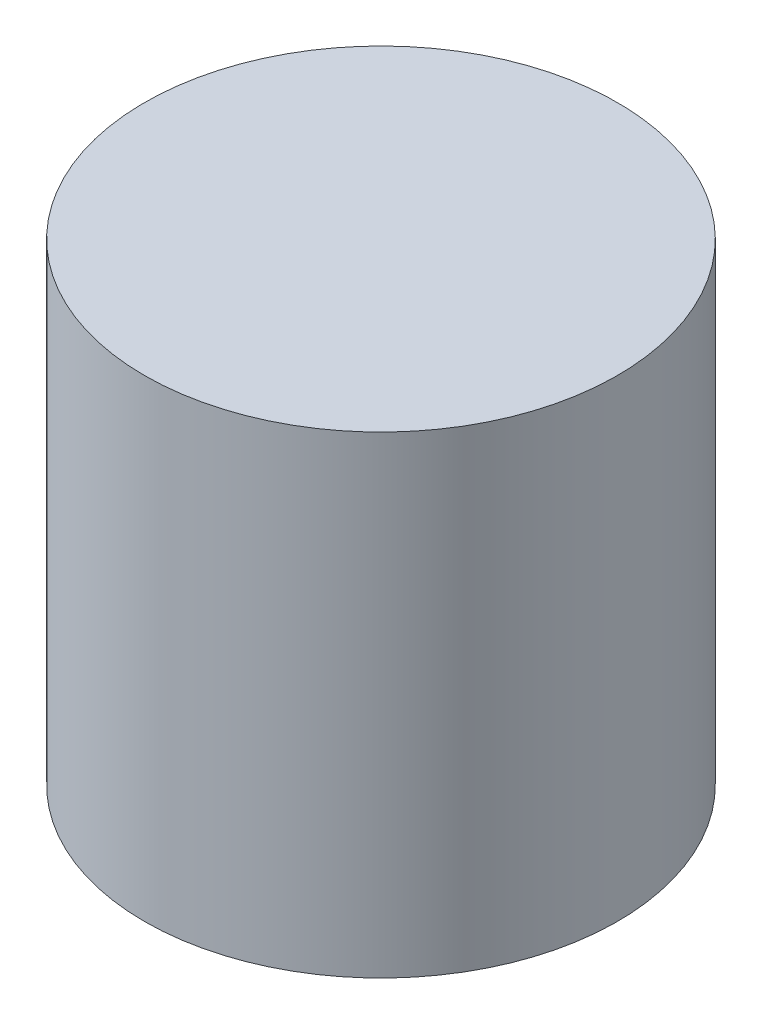
from build123d import *

# Parameters (mm, degrees)
ESQUISSE3_R        = 2
BOSS_EXTRU_1_DEPTH = 4


with BuildPart() as part:
    # Esquisse3 → Boss.-Extru.1 (new body)
    with BuildSketch(Plane(origin=(0, 0, 0), x_dir=(1, 0, 0), z_dir=(0, 1, 0))):
        Circle(ESQUISSE3_R)
    extrude(amount=BOSS_EXTRU_1_DEPTH)


solid = part.part
